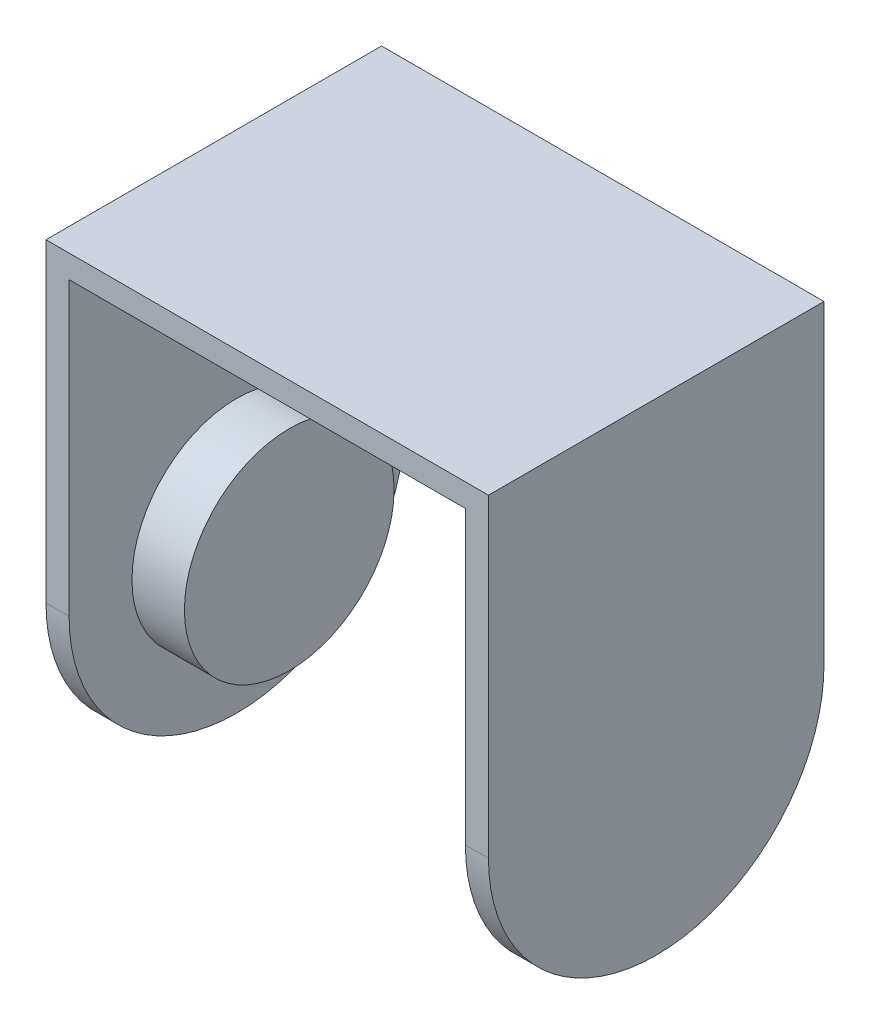
from build123d import *

# Parameters (mm, degrees)
BOSS_EXTRUDE1_DEPTH = 32
FILLET1_R           = 16
SKETCH4_R           = 10
BOSS_EXTRUDE4_DEPTH = 5


with BuildPart() as part:
    # Sketch1 → Boss-Extrude1 (new body)
    with BuildSketch(Plane.XY):
        Polygon((0, 0), (0, 46), (42.2, 46), (42.2, 0), (40, 0), (40, 43.8), (2.2, 43.8), (2.2, 0), align=None)
    extrude(amount=BOSS_EXTRUDE1_DEPTH)

    # Fillet1
    fillet1_edges = [part.edges().sort_by_distance(p)[0] for p in [
        (41.1, 0, 32),
        (41.1, 0, 0),
        (1.1, 0, 0),
        (1.1, 0, 32),
    ]]
    fillet(fillet1_edges, radius=FILLET1_R - 0.0001)  # a hair under: the kernel refuses the full size

    # Sketch4 → Boss-Extrude4 (add)
    with BuildSketch(Plane(origin=(2.2, 0, 0), x_dir=(0, 0, -1), z_dir=(1, 0, 0))):
        with Locations(Location((-16, 16, 0), (0, 0, 270))):
            Circle(SKETCH4_R)
    boss_extrude4 = extrude(amount=BOSS_EXTRUDE4_DEPTH)

    # Mirror1: Boss-Extrude4 across plane
    add(boss_extrude4.mirror(Plane(origin=(21.1, 0, 0), x_dir=(0, 0, 1), z_dir=(1, 0, 0))))


solid = part.part
